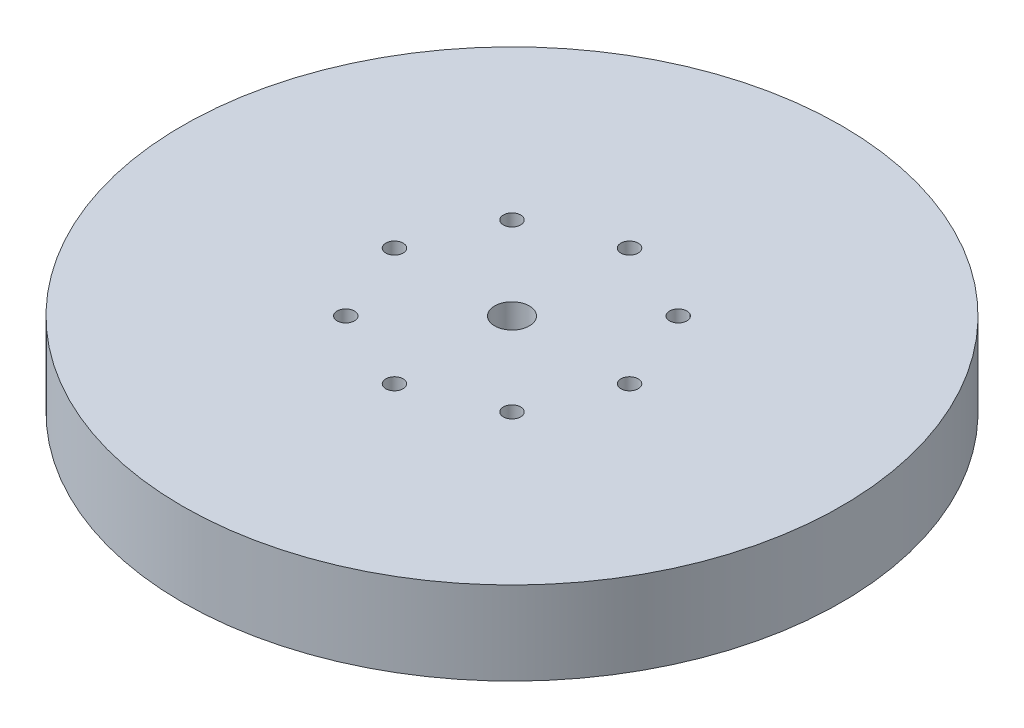
from build123d import *

# Parameters (mm, degrees)
SKETCH1_R           = 95
BOSS_EXTRUDE1_DEPTH = 24
SKETCH2_R           = 5
CUT_EXTRUDE1_DEPTH  = 137.477104307
SKETCH3_R           = 2.496651273
CUT_EXTRUDE2_DEPTH  = 21.133282916
CIRPATTERN1_COUNT   = 8


with BuildPart() as part:
    # Sketch1 → Boss-Extrude1 (new body)
    with BuildSketch(Plane(origin=(0, 0, 0), x_dir=(1, 0, 0), z_dir=(0, 1, 0))):
        Circle(SKETCH1_R)
    extrude(amount=BOSS_EXTRUDE1_DEPTH)

    # Sketch2 → Cut-Extrude1 (cut, through all)
    with BuildSketch(Plane(origin=(0, 0, 0), x_dir=(1, 0, 0), z_dir=(0, 1, 0))):
        Circle(SKETCH2_R)
    extrude(amount=CUT_EXTRUDE1_DEPTH, mode=Mode.SUBTRACT)

    # Sketch3 → Cut-Extrude2 (cut)
    with BuildSketch(Plane(origin=(0, 24, 0), x_dir=(1, 0, 0), z_dir=(0, 1, 0))):
        with Locations((-33.881805087, 0)):
            Circle(SKETCH3_R)
    cut_extrude2 = extrude(amount=-CUT_EXTRUDE2_DEPTH, mode=Mode.SUBTRACT)

    # CirPattern1: Cut-Extrude2 ×8 about axis
    cirpattern1_axis = Axis((0, 0, 0), (0, 1, 0))
    for i in range(1, CIRPATTERN1_COUNT):
        add(cut_extrude2.rotate(cirpattern1_axis, i * 360 / CIRPATTERN1_COUNT), mode=Mode.SUBTRACT)


solid = part.part
